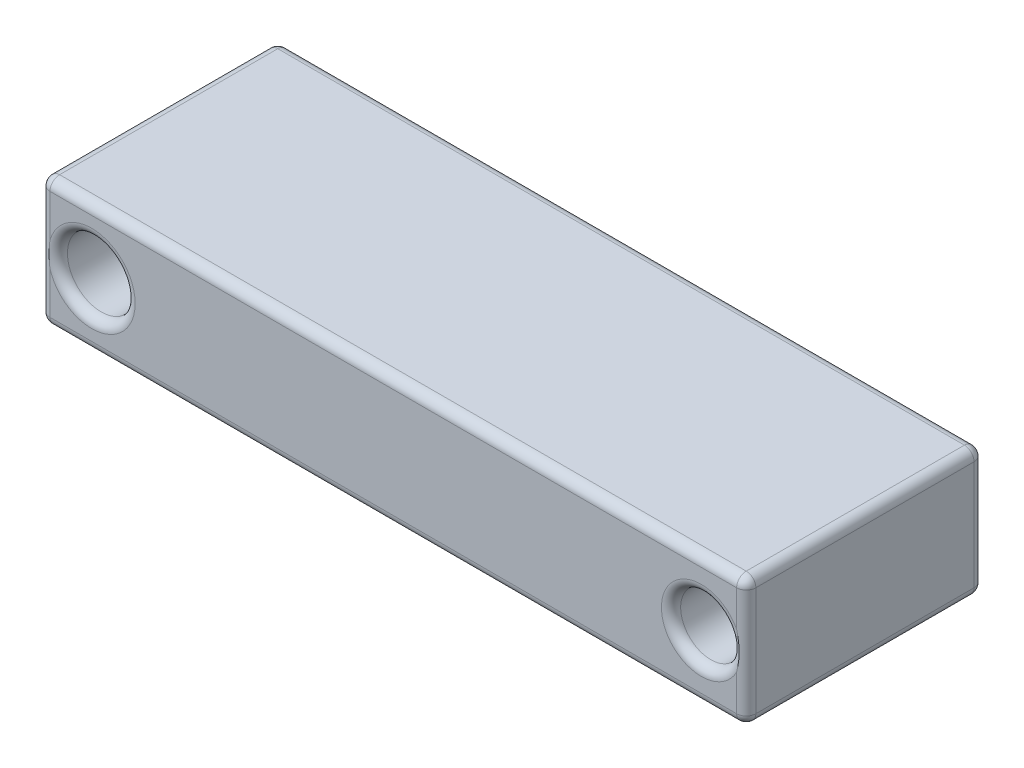
from build123d import *

# Parameters (mm, degrees)
SKETCH1_W      = 110
SKETCH1_H      = 20
EXTRUDE1_DEPTH = 37
SKETCH2_R      = 5.275032214
SKETCH2_R_2    = 4.714043742
EXTRUDE2_DEPTH = 110
FILLET1_R      = 1.5


with BuildPart() as part:
    # Sketch1 → Extrude1 (new body)
    with BuildSketch(Plane.XY):
        with Locations((-40.381896345, 45.506224595)):
            Rectangle(SKETCH1_W, SKETCH1_H)
    extrude(amount=EXTRUDE1_DEPTH)

    # Sketch2 → Extrude2 (cut)
    with BuildSketch(Plane.XY.offset(37)):
        with Locations((-87.381896345, 45.506224595)):
            Circle(SKETCH2_R)
        with Locations((7.618103655, 45.506224595)):
            Circle(SKETCH2_R_2)
    extrude(amount=-EXTRUDE2_DEPTH, mode=Mode.SUBTRACT)

    # Fillet1
    # the kernel refuses this fillet: 1.5 mm, written as the material it takes off along each edge
    with BuildSketch(Plane(origin=(13.118103655, 54.006224595, 35.5), x_dir=(1, 0, 0), z_dir=(0, 1, 0))) as fillet1_piece_1_section:
        Polygon((0, 0), (FILLET1_R, 0), (FILLET1_R, -FILLET1_R), (0, -FILLET1_R), align=None)
    fillet1_piece_1 = extrude(amount=FILLET1_R, mode=Mode.PRIVATE)
    fillet1_piece_1 = fillet1_piece_1 - Plane(origin=(13.118103655, 54.006224595, 35.5), x_dir=(-0.7071067811865475, 0, -0.7071067811865475), z_dir=(0, 1, 0)) * Sphere(FILLET1_R, mode=Mode.PRIVATE)
    add(fillet1_piece_1, mode=Mode.SUBTRACT)
    with BuildSketch(Plane(origin=(13.118103655, 37.006224595, 35.5), x_dir=(0, 0, 1), z_dir=(1, 0, 0))) as fillet1_piece_2_section:
        Polygon((0, 0), (FILLET1_R, 0), (FILLET1_R, FILLET1_R), (0, FILLET1_R), align=None)
    fillet1_piece_2 = extrude(amount=FILLET1_R, mode=Mode.PRIVATE)
    fillet1_piece_2 = fillet1_piece_2 - Plane(origin=(13.118103655, 37.006224595, 35.5), x_dir=(0, 0.7071067811865475, -0.7071067811865475), z_dir=(1, 0, 0)) * Sphere(FILLET1_R, mode=Mode.PRIVATE)
    add(fillet1_piece_2, mode=Mode.SUBTRACT)
    with BuildSketch(Plane(origin=(-93.881896345, 54.006224595, 35.5), x_dir=(-1, 0, 0), z_dir=(0, 1, 0))) as fillet1_piece_3_section:
        Polygon((0, 0), (FILLET1_R, 0), (FILLET1_R, FILLET1_R), (0, FILLET1_R), align=None)
    fillet1_piece_3 = extrude(amount=FILLET1_R, mode=Mode.PRIVATE)
    fillet1_piece_3 = fillet1_piece_3 - Plane(origin=(-93.881896345, 54.006224595, 35.5), x_dir=(0.7071067811865475, 0, -0.7071067811865475), z_dir=(0, 1, 0)) * Sphere(FILLET1_R, mode=Mode.PRIVATE)
    add(fillet1_piece_3, mode=Mode.SUBTRACT)
    with BuildSketch(Plane(origin=(-93.881896345, 37.006224595, 35.5), x_dir=(0, 0, 1), z_dir=(-1, 0, 0))) as fillet1_piece_4_section:
        Polygon((0, 0), (FILLET1_R, 0), (FILLET1_R, -FILLET1_R), (0, -FILLET1_R), align=None)
    fillet1_piece_4 = extrude(amount=FILLET1_R, mode=Mode.PRIVATE)
    fillet1_piece_4 = fillet1_piece_4 - Plane(origin=(-93.881896345, 37.006224595, 35.5), x_dir=(0, 0.7071067811865475, -0.7071067811865475), z_dir=(-1, 0, 0)) * Sphere(FILLET1_R, mode=Mode.PRIVATE)
    add(fillet1_piece_4, mode=Mode.SUBTRACT)
    with BuildSketch(Plane(origin=(-93.881896345, 54.006224595, 1.5), x_dir=(-1, 0, 0), z_dir=(0, 1, 0))) as fillet1_piece_5_section:
        Polygon((0, 0), (FILLET1_R, 0), (FILLET1_R, -FILLET1_R), (0, -FILLET1_R), align=None)
    fillet1_piece_5 = extrude(amount=FILLET1_R, mode=Mode.PRIVATE)
    fillet1_piece_5 = fillet1_piece_5 - Plane(origin=(-93.881896345, 54.006224595, 1.5), x_dir=(0.7071067811865475, 0, 0.7071067811865475), z_dir=(0, 1, 0)) * Sphere(FILLET1_R, mode=Mode.PRIVATE)
    add(fillet1_piece_5, mode=Mode.SUBTRACT)
    with BuildSketch(Plane(origin=(13.118103655, 54.006224595, 1.5), x_dir=(1, 0, 0), z_dir=(0, 1, 0))) as fillet1_piece_6_section:
        Polygon((0, 0), (FILLET1_R, 0), (FILLET1_R, FILLET1_R), (0, FILLET1_R), align=None)
    fillet1_piece_6 = extrude(amount=FILLET1_R, mode=Mode.PRIVATE)
    fillet1_piece_6 = fillet1_piece_6 - Plane(origin=(13.118103655, 54.006224595, 1.5), x_dir=(-0.7071067811865475, 0, 0.7071067811865475), z_dir=(0, 1, 0)) * Sphere(FILLET1_R, mode=Mode.PRIVATE)
    add(fillet1_piece_6, mode=Mode.SUBTRACT)
    with BuildSketch(Plane(origin=(13.118103655, 37.006224595, 1.5), x_dir=(0, 0, -1), z_dir=(1, 0, 0))) as fillet1_piece_7_section:
        Polygon((0, 0), (FILLET1_R, 0), (FILLET1_R, -FILLET1_R), (0, -FILLET1_R), align=None)
    fillet1_piece_7 = extrude(amount=FILLET1_R, mode=Mode.PRIVATE)
    fillet1_piece_7 = fillet1_piece_7 - Plane(origin=(13.118103655, 37.006224595, 1.5), x_dir=(0, 0.7071067811865475, 0.7071067811865475), z_dir=(1, 0, 0)) * Sphere(FILLET1_R, mode=Mode.PRIVATE)
    add(fillet1_piece_7, mode=Mode.SUBTRACT)
    with BuildSketch(Plane(origin=(-93.881896345, 37.006224595, 1.5), x_dir=(0, 0, -1), z_dir=(-1, 0, 0))) as fillet1_piece_8_section:
        Polygon((0, 0), (FILLET1_R, 0), (FILLET1_R, FILLET1_R), (0, FILLET1_R), align=None)
    fillet1_piece_8 = extrude(amount=FILLET1_R, mode=Mode.PRIVATE)
    fillet1_piece_8 = fillet1_piece_8 - Plane(origin=(-93.881896345, 37.006224595, 1.5), x_dir=(0, 0.7071067811865475, 0.7071067811865475), z_dir=(-1, 0, 0)) * Sphere(FILLET1_R, mode=Mode.PRIVATE)
    add(fillet1_piece_8, mode=Mode.SUBTRACT)
    with BuildSketch(Plane(origin=(14.618103655, 54.006224595, 37), x_dir=(0, 0, -1), z_dir=(0, -1, 0)), Plane(origin=(-95.381896345, 37.006224595, 37), x_dir=(0, 0, -1), z_dir=(0, 1, 0))) as fillet1_piece_9:
        with BuildLine():
            CenterArc((FILLET1_R, -FILLET1_R), FILLET1_R, 90, 90)
            Line((0, -FILLET1_R), (0, 0))
            Line((0, 0), (FILLET1_R, 0))
        make_face()
    extrude(amount=17, mode=Mode.SUBTRACT)
    with BuildSketch(Plane(origin=(-93.881896345, 55.506224595, 37), x_dir=(0, 0, -1), z_dir=(1, 0, 0)), Plane(origin=(13.118103655, 35.506224595, 0), x_dir=(0, 1, 0), z_dir=(-1, 0, 0))) as fillet1_piece_10:
        with BuildLine():
            CenterArc((FILLET1_R, -FILLET1_R), FILLET1_R, 90, 90)
            Line((0, -FILLET1_R), (0, 0))
            Line((0, 0), (FILLET1_R, 0))
        make_face()
    extrude(amount=107, mode=Mode.SUBTRACT)
    with BuildSketch(Plane(origin=(-87.381896345, 45.506224595, 0), x_dir=(1, 0, 0), z_dir=(0, -1, 0))) as fillet1_piece_11:
        with BuildLine():
            CenterArc((5.275032214 + FILLET1_R, FILLET1_R), FILLET1_R, 180, 90)
            Line((5.275032214, FILLET1_R), (5.275032214, 0))
            Line((5.275032214, 0), (5.275032214 + FILLET1_R, 0))
        make_face()
    revolve(axis=Axis((-87.381896345, 45.506224595, 0), (0, 0, 1)), mode=Mode.SUBTRACT)
    with BuildSketch(Plane(origin=(-87.381896345, 45.506224595, 37), x_dir=(1, 0, 0), z_dir=(0, -1, 0))) as fillet1_piece_12:
        with BuildLine():
            CenterArc((5.275032214 + FILLET1_R, -FILLET1_R), FILLET1_R, 90, 90)
            Line((5.275032214, -FILLET1_R), (5.275032214, 0))
            Line((5.275032214, 0), (5.275032214 + FILLET1_R, 0))
        make_face()
    revolve(axis=Axis((-87.381896345, 45.506224595, 37), (0, 0, 1)), mode=Mode.SUBTRACT)
    with BuildSketch(Plane(origin=(7.618103655, 45.506224595, 0), x_dir=(1, 0, 0), z_dir=(0, -1, 0))) as fillet1_piece_13:
        with BuildLine():
            CenterArc((4.714043742 + FILLET1_R, FILLET1_R), FILLET1_R, 180, 90)
            Line((4.714043742, FILLET1_R), (4.714043742, 0))
            Line((4.714043742, 0), (4.714043742 + FILLET1_R, 0))
        make_face()
    revolve(axis=Axis((7.618103655, 45.506224595, 0), (0, 0, 1)), mode=Mode.SUBTRACT)
    with BuildSketch(Plane(origin=(7.618103655, 45.506224595, 37), x_dir=(1, 0, 0), z_dir=(0, -1, 0))) as fillet1_piece_14:
        with BuildLine():
            CenterArc((4.714043742 + FILLET1_R, -FILLET1_R), FILLET1_R, 90, 90)
            Line((4.714043742, -FILLET1_R), (4.714043742, 0))
            Line((4.714043742, 0), (4.714043742 + FILLET1_R, 0))
        make_face()
    revolve(axis=Axis((7.618103655, 45.506224595, 37), (0, 0, 1)), mode=Mode.SUBTRACT)
    with BuildSketch(Plane(origin=(-93.881896345, 55.506224595, 0), x_dir=(0, 0, 1), z_dir=(1, 0, 0)), Plane(origin=(13.118103655, 35.506224595, 37), x_dir=(0, 1, 0), z_dir=(-1, 0, 0))) as fillet1_piece_15:
        with BuildLine():
            CenterArc((FILLET1_R, FILLET1_R), FILLET1_R, 180, 90)
            Line((0, FILLET1_R), (0, 0))
            Line((0, 0), (FILLET1_R, 0))
        make_face()
    extrude(amount=107, mode=Mode.SUBTRACT)
    with BuildSketch(Plane(origin=(14.618103655, 54.006224595, 0), x_dir=(0, 0, 1), z_dir=(0, -1, 0)), Plane(origin=(-95.381896345, 37.006224595, 0), x_dir=(0, 0, 1), z_dir=(0, 1, 0))) as fillet1_piece_16:
        with BuildLine():
            CenterArc((FILLET1_R, FILLET1_R), FILLET1_R, 180, 90)
            Line((0, FILLET1_R), (0, 0))
            Line((0, 0), (FILLET1_R, 0))
        make_face()
    extrude(amount=17, mode=Mode.SUBTRACT)
    with BuildSketch(Plane(origin=(-95.381896345, 55.506224595, 1.5), x_dir=(1, 0, 0), z_dir=(0, 0, 1)), Plane(origin=(-95.381896345, 35.506224595, 1.5), x_dir=(0, 1, 0), z_dir=(0, 0, 1))) as fillet1_piece_17:
        with BuildLine():
            CenterArc((FILLET1_R, -FILLET1_R), FILLET1_R, 90, 90)
            Line((0, -FILLET1_R), (0, 0))
            Line((0, 0), (FILLET1_R, 0))
        make_face()
    extrude(amount=34, mode=Mode.SUBTRACT)
    with BuildSketch(Plane(origin=(14.618103655, 55.506224595, 1.5), x_dir=(-1, 0, 0), z_dir=(0, 0, 1)), Plane(origin=(14.618103655, 35.506224595, 1.5), x_dir=(0, 1, 0), z_dir=(0, 0, 1))) as fillet1_piece_18:
        with BuildLine():
            CenterArc((FILLET1_R, FILLET1_R), FILLET1_R, 180, 90)
            Line((0, FILLET1_R), (0, 0))
            Line((0, 0), (FILLET1_R, 0))
        make_face()
    extrude(amount=34, mode=Mode.SUBTRACT)


solid = part.part
